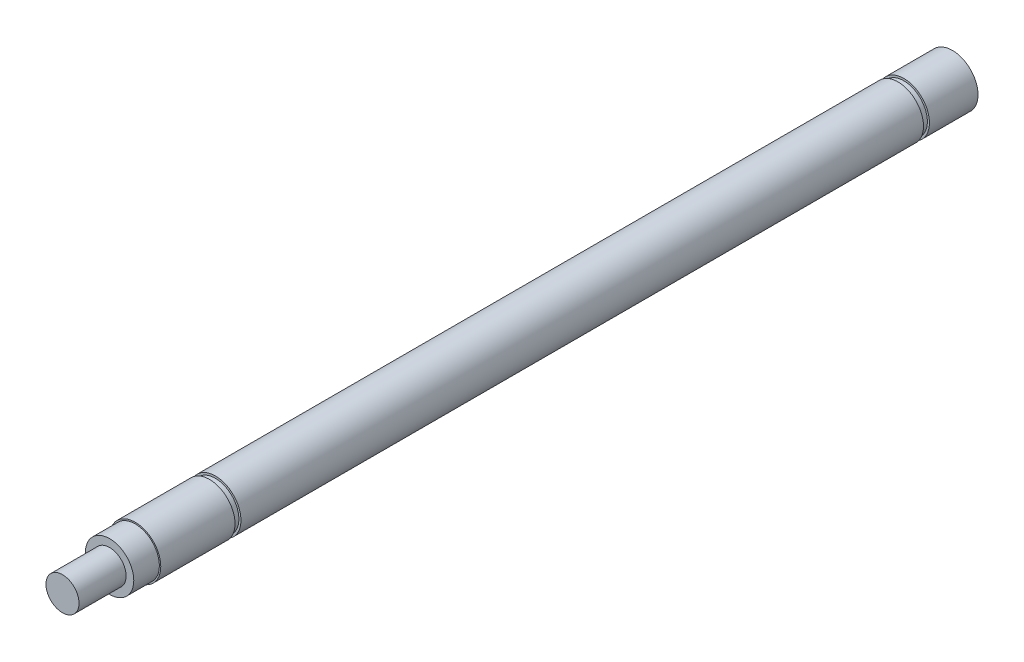
from build123d import *


with BuildPart() as part:
    # Sketch1 → Revolve1 (revolve)
    with BuildSketch(Plane(origin=(0, 0, 0), x_dir=(1, 0, 0), z_dir=(0, 1, 0))):
        Polygon((3.175, 99.795553682), (0, 99.795553682), (0, -10.6045), (2.05, -10.6045), (2.05, -4.7625), (3, -4.7625), (3, -1.5875), (3.175, -1.5875), (3.175, 7.62), (2.921, 7.62), (2.921, 8.3566), (3.175, 8.3566), (3.175, 93.032803682), (2.921, 93.032803682), (2.921, 93.769403682), (3.175, 93.769403682), align=None)
    revolve(axis=Axis((0, 0, 10.6045), (0, 0, -1)))


solid = part.part
